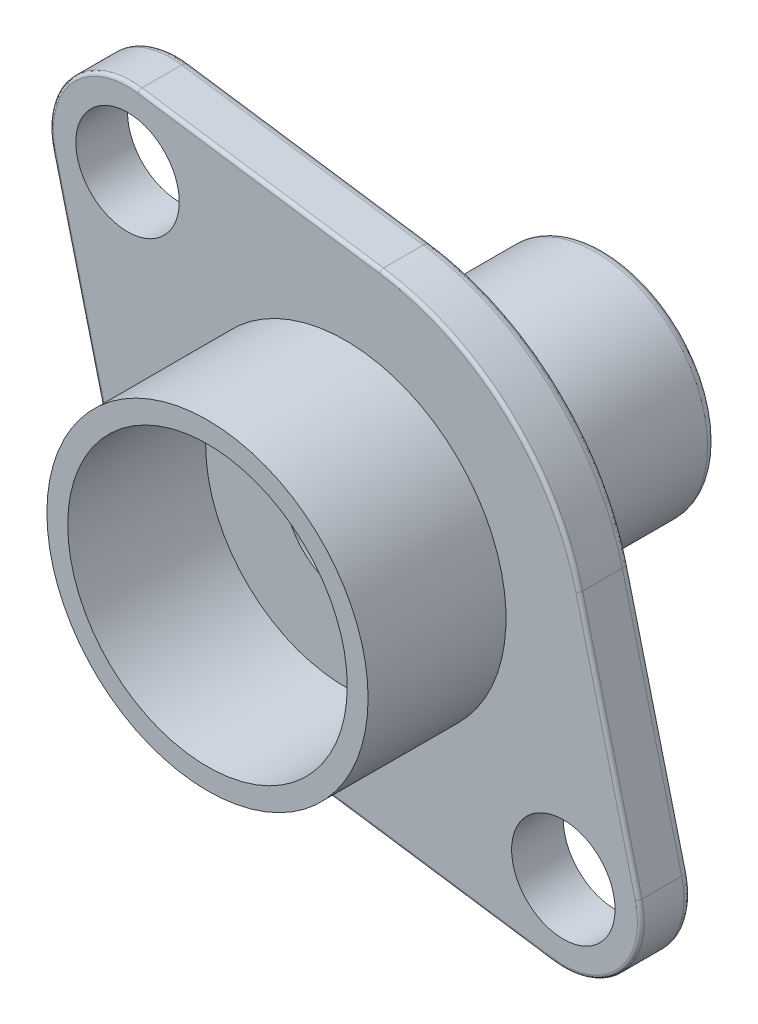
from build123d import *

# Parameters (mm, degrees)
EXTRUDE1_DEPTH      = 3
EXTRUDE3_DEPTH      = 1
EXTRUDE2_DEPTH      = 12
EXTRUDE2_DEPTH_BACK = 2
SKETCH2_R           = 6.5
FILLET1_R           = 3
FILLET2_R           = 0.5
FILLET3_R           = 0.2
SKETCH4_R           = 9.313469465
SKETCH4_R_2         = 8.105631026
EXTRUDE4_DEPTH      = 8
SKETCH5_R           = 3.5
EXTRUDE5_DEPTH      = 33.814613768
SKETCH7_R           = 3
EXTRUDE6_DEPTH      = 17


with BuildPart() as part:
    # Sketch1 → Extrude1 (new body)
    with BuildSketch(Plane.XY):
        with BuildLine():
            Line((-2.009062408, -13.853800871), (11.995503151, -15.89518814))
            add(Edge.make_bspline(
                [(11.995503151, -15.89518814), (12.362364465, -15.948663988), (12.729423245, -15.956456944), (13.280303875, -15.900486447), (13.463565947, -15.870290209), (13.821020557, -15.788656599), (13.99637905, -15.737131289), (14.512420636, -15.550660438), (14.846352189, -15.381200204), (15.301696452, -15.074688977), (15.446801079, -14.963588385), (15.72360591, -14.723458847), (15.856061079, -14.59356358), (16.22666437, -14.182109446), (16.436185625, -13.882569216), (16.694990267, -13.395970064), (16.772207693, -13.226424094), (16.90376124, -12.883019846), (17.013462076, -12.533922859), (17.080269532, -12.173651931), (17.125061191, -11.807645779), (17.13621408, -11.622123018), (17.135649182, -11.071973309), (17.091166335, -10.708719447), (17.001131625, -10.349093325)],
                knots=[0, 0, 0, 0, 0.125, 0.125, 0.1875, 0.1875, 0.25, 0.25, 0.375, 0.375, 0.4375, 0.4375, 0.5, 0.5, 0.625, 0.625, 0.6875, 0.6875, 0.75, 0.8125, 0.8125, 0.875, 0.875, 1, 1, 1, 1], degree=3))
            Line((17.001131625, -10.349093325), (13.558736328, 3.400884541))
            add(Edge.make_bspline(
                [(13.558736328, 3.400884541), (13.221524337, 4.747812194), (12.696884691, 6.012397528), (11.811080196, 7.49208146), (11.621344266, 7.783956041), (11.223521212, 8.348881882), (11.015193782, 8.622547328), (10.362581964, 9.417728816), (9.890814108, 9.913566479), (8.873544785, 10.836350946), (8.323185381, 11.266038086), (7.178225412, 12.0304101), (6.582199315, 12.367535027), (5.653339324, 12.806584455), (5.337892367, 12.941782992), (4.695140946, 13.18948791), (4.366835454, 13.30228202), (3.37137699, 13.603172145), (2.696077299, 13.753657568), (2.009062408, 13.853800871)],
                knots=[0, 0, 0, 0, 0.25, 0.25, 0.3125, 0.3125, 0.375, 0.375, 0.5, 0.5, 0.625, 0.625, 0.75, 0.75, 0.8125, 0.8125, 0.875, 0.875, 1, 1, 1, 1], degree=3))
            Line((2.009062408, 13.853800871), (-11.995503151, 15.89518814))
            add(Edge.make_bspline(
                [(-11.995503151, 15.89518814), (-12.362364465, 15.948663988), (-12.729423245, 15.956456944), (-13.280303875, 15.900486447), (-13.463565947, 15.870290209), (-13.821020557, 15.788656599), (-13.99637905, 15.737131289), (-14.512420636, 15.550660438), (-14.846352189, 15.381200204), (-15.301696452, 15.074688977), (-15.446801079, 14.963588385), (-15.72360591, 14.723458847), (-15.856061079, 14.59356358), (-16.22666437, 14.182109446), (-16.436185625, 13.882569216), (-16.694990267, 13.395970064), (-16.772207693, 13.226424094), (-16.90376124, 12.883019846), (-17.013462683, 12.533923017), (-17.080269532, 12.173651931), (-17.125061191, 11.807645779), (-17.13621408, 11.622123018), (-17.135649182, 11.071973309), (-17.091166335, 10.708719447), (-17.001131625, 10.349093325)],
                knots=[0, 0, 0, 0, 0.125, 0.125, 0.1875, 0.1875, 0.25, 0.25, 0.375, 0.375, 0.4375, 0.4375, 0.5, 0.5, 0.625, 0.625, 0.6875, 0.6875, 0.75, 0.8125, 0.8125, 0.875, 0.875, 1, 1, 1, 1], degree=3))
            Line((-17.001131625, 10.349093325), (-13.558736328, -3.400884541))
            add(Edge.make_bspline(
                [(-13.558736328, -3.400884541), (-13.221524337, -4.747812194), (-12.696884691, -6.012397528), (-11.811080196, -7.49208146), (-11.621344266, -7.783956041), (-11.223521212, -8.348881882), (-11.015193782, -8.622547328), (-10.362581964, -9.417728816), (-9.890814108, -9.913566479), (-8.873544785, -10.836350946), (-8.323185381, -11.266038086), (-7.178225412, -12.0304101), (-6.582199315, -12.367535027), (-5.653339324, -12.806584455), (-5.337892367, -12.941782992), (-4.695140946, -13.18948791), (-4.366835454, -13.30228202), (-3.37137699, -13.603172145), (-2.696077299, -13.753657568), (-2.009062408, -13.853800871)],
                knots=[0, 0, 0, 0, 0.25, 0.25, 0.3125, 0.3125, 0.375, 0.375, 0.5, 0.5, 0.625, 0.625, 0.75, 0.75, 0.8125, 0.8125, 0.875, 0.875, 1, 1, 1, 1], degree=3))
        make_face()
    extrude(amount=EXTRUDE1_DEPTH)

    # Sketch3 → Extrude3 (cut)
    with BuildSketch(Plane(origin=(0, 0, 0), x_dir=(-1, 0, 0), z_dir=(0, 0, -1))):
        with BuildLine():
            Line((11.618614145, -2.915162488), (13.365865641, 4.063893468))
            ThreePointArc((13.365865641, 4.063893468), (13.082885072, 6.240857002), (11.393110949, 7.64225332))
            add(Edge.make_bspline(
                [(8.73827016, 10.583232997), (8.759511669, 10.486402538), (8.784346381, 10.390287675), (8.88785827, 10.043930455), (8.986582654, 9.802879009), (9.230469119, 9.3412384), (9.37738945, 9.119140538), (9.706811345, 8.714137661), (9.890045654, 8.528984076), (10.294198115, 8.193969305), (10.5136335, 8.046088753), (10.949831794, 7.810417326), (11.167093296, 7.716601392), (11.393110949, 7.64225332)],
                knots=[0.800703513, 0.800703513, 0.800703513, 0.800703513, 0.8125, 0.8125, 0.84375, 0.84375, 0.875, 0.875, 0.90625, 0.90625, 0.9375, 0.9375, 0.965743106, 0.965743106, 0.965743106, 0.965743106], degree=3))
            ThreePointArc((8.73827016, 10.583232997), (7.514361342, 12.407832948), (5.375224215, 12.909041619))
            Line((5.375224215, 12.909041619), (-1.720579415, 11.874715839))
            add(Edge.make_bspline(
                [(-1.720579415, 11.874715839), (-2.898196772, 11.703059455), (-4.021447728, 11.363720774), (-5.358895836, 10.734084955), (-5.62398411, 10.597109753), (-6.139477166, 10.305851046), (-6.390490674, 10.151378976), (-7.12396639, 9.662267603), (-7.586834404, 9.301894544), (-8.460201794, 8.512370816), (-8.873283701, 8.079345673), (-9.622122133, 7.16787541), (-9.960247446, 6.688183604), (-10.564988947, 5.681598654), (-10.833241477, 5.152727758), (-11.28871541, 4.055433822), (-11.474124008, 3.49230021), (-11.618614145, 2.915162488)],
                knots=[0, 0, 0, 0, 0.25, 0.25, 0.3125, 0.3125, 0.375, 0.375, 0.5, 0.5, 0.625, 0.625, 0.75, 0.75, 0.875, 0.875, 1, 1, 1, 1], degree=3))
            Line((-11.618614145, 2.915162488), (-13.365865641, -4.063893468))
            ThreePointArc((-13.365865641, -4.063893468), (-13.082885072, -6.240857002), (-11.393110949, -7.64225332))
            add(Edge.make_bspline(
                [(-8.73827016, -10.583232997), (-8.759511669, -10.486402538), (-8.784346381, -10.390287675), (-8.88785827, -10.043930455), (-8.986582654, -9.802879009), (-9.230469119, -9.3412384), (-9.37738945, -9.119140538), (-9.706811345, -8.714137661), (-9.890045654, -8.528984076), (-10.294198115, -8.193969305), (-10.5136335, -8.046088753), (-10.949831794, -7.810417326), (-11.167093296, -7.716601392), (-11.393110949, -7.64225332)],
                knots=[0.800703513, 0.800703513, 0.800703513, 0.800703513, 0.8125, 0.8125, 0.84375, 0.84375, 0.875, 0.875, 0.90625, 0.90625, 0.9375, 0.9375, 0.965743106, 0.965743106, 0.965743106, 0.965743106], degree=3))
            ThreePointArc((-8.73827016, -10.583232997), (-7.514361342, -12.407832948), (-5.375224215, -12.909041619))
            Line((-5.375224215, -12.909041619), (1.720579415, -11.874715839))
            add(Edge.make_bspline(
                [(1.720579415, -11.874715839), (2.898196772, -11.703059455), (4.021447728, -11.363720774), (5.358895836, -10.734084955), (5.62398411, -10.597109753), (6.139477166, -10.305851046), (6.390490674, -10.151378976), (7.12396639, -9.662267603), (7.586834404, -9.301894544), (8.460201794, -8.512370816), (8.873283701, -8.079345673), (9.622122133, -7.16787541), (9.960247446, -6.688183604), (10.564988947, -5.681598654), (10.833241477, -5.152727758), (11.28871541, -4.055433822), (11.474124008, -3.49230021), (11.618614145, -2.915162488)],
                knots=[0, 0, 0, 0, 0.25, 0.25, 0.3125, 0.3125, 0.375, 0.375, 0.5, 0.5, 0.625, 0.625, 0.75, 0.75, 0.875, 0.875, 1, 1, 1, 1], degree=3))
        make_face()
    extrude(amount=-EXTRUDE3_DEPTH, mode=Mode.SUBTRACT)

    # Sketch2 → Extrude2 (add, two sides: drawn at the far end of the back side and taken through both)
    with BuildSketch(Plane(origin=(0, 0, 0), x_dir=(-1, 0, 0), z_dir=(0, 0, -1)).offset(-EXTRUDE2_DEPTH_BACK)):
        Circle(SKETCH2_R)
    extrude(amount=EXTRUDE2_DEPTH + EXTRUDE2_DEPTH_BACK)

    # Fillet1
    fillet1_edges = [part.edges().sort_by_distance(p)[0] for p in [
        (6.5, 0, 1),
    ]]
    fillet(fillet1_edges, radius=FILLET1_R)

    # Fillet2
    fillet2_edges = [part.edges().sort_by_distance(p)[0] for p in [
        (9.5, 0, 1),
        (1.8273224, -12.391878729, 1),
        (7.514361342, -12.407832948, 1),
        (9.675983232, -8.760386057, 1),
        (13.082885072, -6.240857002, 1),
        (12.492239893, -0.57436549, 1),
        (-1.8273224, 12.391878729, 1),
        (-7.514361342, 12.407832948, 1),
        (-9.675983232, 8.760386057, 1),
        (-13.082885072, 6.240857002, 1),
        (-7.514361342, 12.407832948, 0),
        (-9.675983232, 8.760386057, 0),
        (-13.082885072, 6.240857002, 0),
        (-12.492239893, 0.57436549, 0),
        (1.8273224, -12.391878729, 0),
        (7.514361342, -12.407832948, 0),
        (9.675983232, -8.760386057, 0),
        (13.082885072, -6.240857002, 0),
        (12.492239893, -0.57436549, 0),
        (8.023518099, 8.90713268, 0),
        (15.279933977, -3.474104392, 0),
        (15.979595509, -14.456412202, 0),
        (4.993220371, -14.874494505, 0),
        (-8.023518099, -8.90713268, 0),
        (-15.279933977, 3.474104392, 0),
        (-15.979595509, 14.456412202, 0),
        (-12.492239893, 0.57436549, 1),
        (-1.8273224, 12.391878729, 0),
        (-4.993220371, 14.874494505, 0),
        (6.5, 0, -12),
    ]]
    fillet(fillet2_edges, radius=FILLET2_R - 0.0001)  # a hair under: the kernel refuses the full size

    # Fillet3
    fillet3_edges = [part.edges().sort_by_distance(p)[0] for p in [
        (7.696206474, 8.529129616, 1),
        (15.279933977, -3.474104392, 3),
        (15.977907731, -14.458284953, 3),
        (4.993220371, -14.874494505, 3),
        (-7.696206474, -8.529129616, 1),
        (-15.279933977, 3.474104392, 3),
        (-15.977907744, 14.458284939, 3),
        (-4.993220371, 14.874494505, 3),
    ]]
    fillet(fillet3_edges, radius=FILLET3_R)

    # Sketch4 → Extrude4 (add)
    with BuildSketch(Plane.XY.offset(3)):
        with Locations(Location((0, 0, 0), (0, 0, 180))):
            Circle(SKETCH4_R)
        Circle(SKETCH4_R_2, mode=Mode.SUBTRACT)
    extrude(amount=EXTRUDE4_DEPTH)

    # Sketch5 → Extrude5 (cut, through all)
    with BuildSketch(Plane(origin=(0, 0, -12), x_dir=(-1, 0, 0), z_dir=(0, 0, -1))):
        Circle(SKETCH5_R)
    extrude(amount=-EXTRUDE5_DEPTH, mode=Mode.SUBTRACT)

    # Sketch7 → Extrude6 (cut)
    with BuildSketch(Plane.XY.offset(3)):
        with Locations((-12.637866431, 11.446548965)):
            Circle(SKETCH7_R)
        with Locations((12.637866431, -11.446548965)):
            Circle(SKETCH7_R)
    extrude(amount=-EXTRUDE6_DEPTH, mode=Mode.SUBTRACT)


solid = part.part
